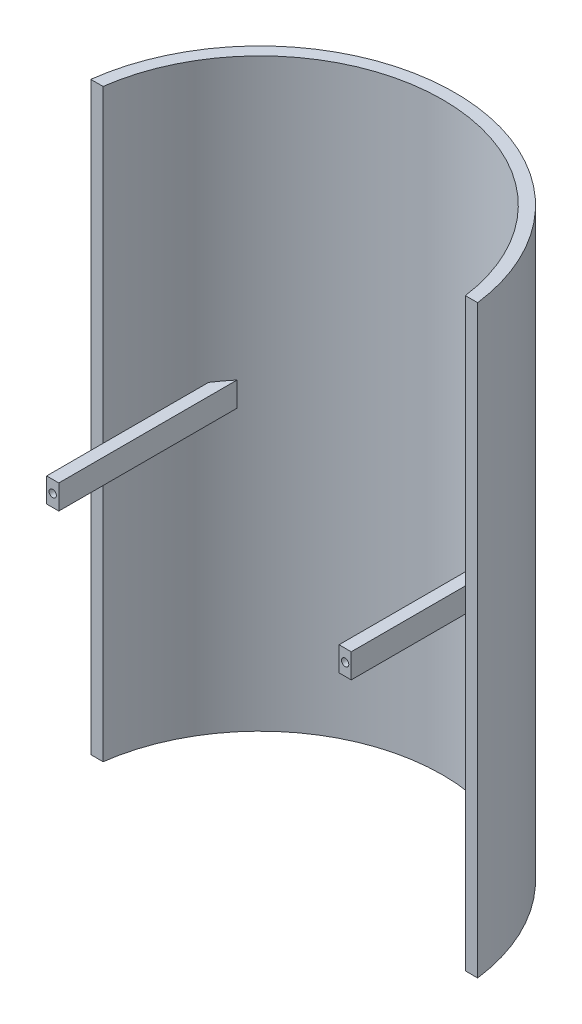
from build123d import *

# Parameters (mm, degrees)
Y_KSEKLIK_EKSTR_ZYON1_DEPTH = 70
KES_EKSTR_ZYON11_DEPTH      = 242
IZIM3_W                     = 100
IZIM3_H                     = 10
Y_KSEKLIK_EKSTR_ZYON4_DEPTH = 2.5
KES_EKSTR_ZYON12_REACH      = 177.214
KES_EKSTR_ZYON12_END_RADIUS = 80
IZIM13_W                    = 5
IZIM13_H                    = 10
IZIM14_R                    = 1.5
KES_EKSTR_ZYON13_DEPTH      = 27


with BuildPart() as part:
    # Çizim1 → Yükseklik-Ekstrüzyon1 (new body)
    with BuildSketch(Plane.XY):
        with BuildLine():
            Line((-80, 120), (80, 120))
            ThreePointArc((80, 120), (87.071067812, 117.071067812), (90, 110))
            Line((90, 110), (90, -110))
            ThreePointArc((90, -110), (87.071067812, -117.071067812), (80, -120))
            Line((80, -120), (-80, -120))
            ThreePointArc((-80, -120), (-87.071067812, -117.071067812), (-90, -110))
            Line((-90, -110), (-90, 110))
            ThreePointArc((-90, 110), (-87.071067812, 117.071067812), (-80, 120))
        make_face()
    extrude(amount=Y_KSEKLIK_EKSTR_ZYON1_DEPTH)

    # Çizim12 → Kes-Ekstrüzyon11 (cut)
    with BuildSketch(Plane(origin=(0, 120, 0), x_dir=(1, 0, 0), z_dir=(0, 1, 0))):
        with BuildLine():
            Line((90, -70), (90, 0))
            Line((90, 0), (2.06e-07, 0))
            ThreePointArc((2.06e-07, 0), (52.915026299, -20.000000068), (79.372539332, -70))
            Line((79.372539332, -70), (90, -70))
        make_face()
        with BuildLine():
            ThreePointArc((-79.372539332, -70), (-52.915026144, -19.999999932), (2.06e-07, 0))
            Line((2.06e-07, 0), (-90, 0))
            Line((-90, 0), (-90, -70))
            Line((-90, -70), (-79.372539332, -70))
        make_face()
        with BuildLine():
            Line((-74.330343737, -70), (74.330343737, -70))
            ThreePointArc((74.330343737, -70), (0, -5), (-74.330343737, -70))
        make_face()
    extrude(amount=-KES_EKSTR_ZYON11_DEPTH, mode=Mode.SUBTRACT)

    # Çizim3 → Yükseklik-Ekstrüzyon4 (add, symmetric)
    with BuildSketch(Plane(origin=(-60, 0, 0), x_dir=(0, 0, -1), z_dir=(1, 0, 0))):
        with Locations((-55, 0)):
            Rectangle(IZIM3_W, IZIM3_H)
    y_kseklik_ekstr_zyon4 = extrude(amount=Y_KSEKLIK_EKSTR_ZYON4_DEPTH, both=True)

    # Kes-Ekstrüzyon12: up to this cylinder (the profile starts outside it)
    kes_ekstr_zyon12_end = Plane(origin=(0, 0, 80), z_dir=(0, 1, 0)) * Cylinder(KES_EKSTR_ZYON12_END_RADIUS, 515.428, mode=Mode.PRIVATE)
    # Çizim13 → Kes-Ekstrüzyon12 (cut, up to the surface)
    with BuildSketch(Plane(origin=(0, 0, 5), x_dir=(-1, 0, 0), z_dir=(0, 0, -1)), mode=Mode.PRIVATE) as kes_ekstr_zyon12_sk1:
        with Locations((60, 0)):
            Rectangle(IZIM13_W, IZIM13_H)
    kes_ekstr_zyon12_tool1 = extrude(kes_ekstr_zyon12_sk1.sketch, amount=-KES_EKSTR_ZYON12_REACH, mode=Mode.PRIVATE) - kes_ekstr_zyon12_end
    kes_ekstr_zyon12 = kes_ekstr_zyon12_tool1.solids().sort_by_distance((-60, 0, 5))[0]
    add(kes_ekstr_zyon12, mode=Mode.SUBTRACT)

    # Çizim14 → Kes-Ekstrüzyon13 (cut)
    with BuildSketch(Plane.XY.offset(105)):
        with Locations((-60, 0)):
            Circle(IZIM14_R)
    kes_ekstr_zyon13 = extrude(amount=-KES_EKSTR_ZYON13_DEPTH, mode=Mode.SUBTRACT)

    # Aynalama4: Yükseklik-Ekstrüzyon4, Kes-Ekstrüzyon12, Kes-Ekstrüzyon13 across plane
    add(y_kseklik_ekstr_zyon4.mirror(Plane(origin=(0, 0, 0), x_dir=(0, 0, 1), z_dir=(1, 0, 0))))
    add(kes_ekstr_zyon12.mirror(Plane(origin=(0, 0, 0), x_dir=(0, 0, 1), z_dir=(1, 0, 0))), mode=Mode.SUBTRACT)
    add(kes_ekstr_zyon13.mirror(Plane(origin=(0, 0, 0), x_dir=(0, 0, 1), z_dir=(1, 0, 0))), mode=Mode.SUBTRACT)


solid = part.part
